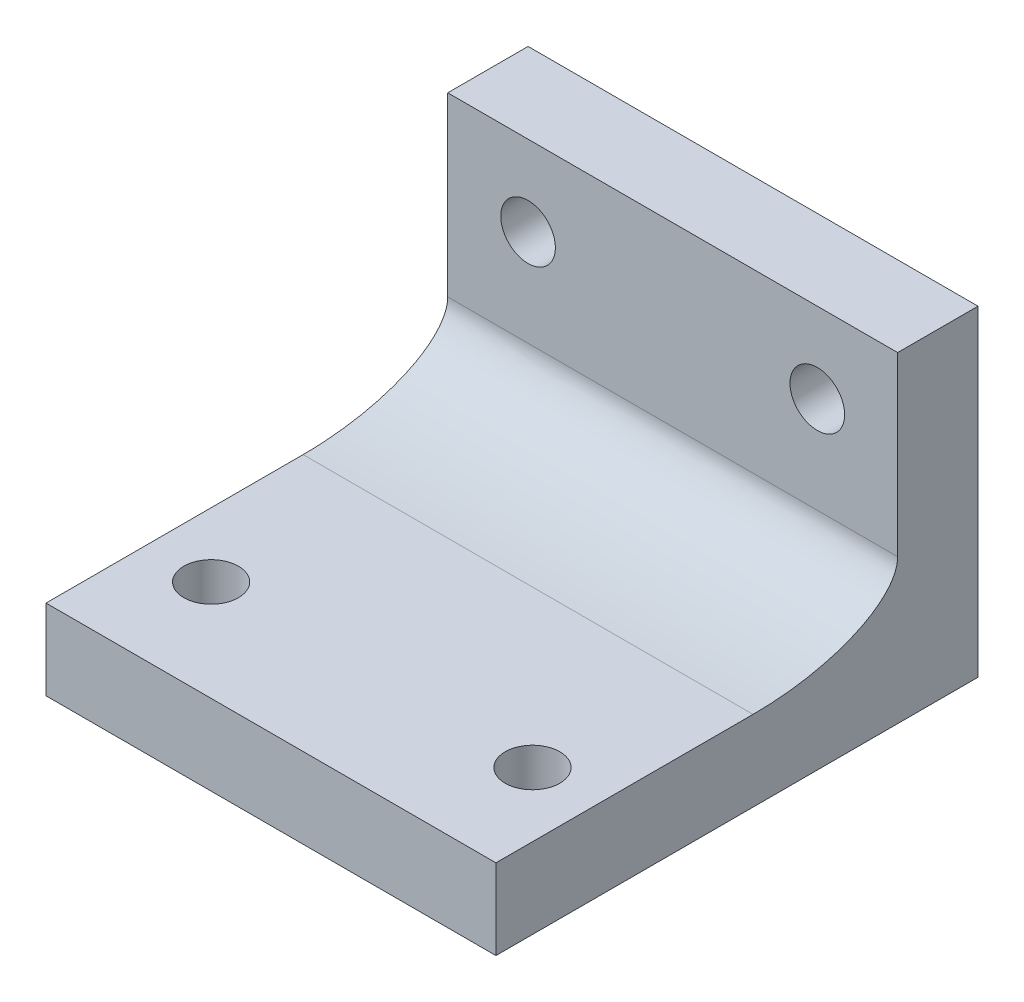
from build123d import *

# Parameters (mm, degrees)
SKETCH_1_W          = 28
SKETCH_1_H          = 30
EXTRUDE_1_DEPTH     = 5
SKETCH_2_W          = 28
SKETCH_2_H          = 5
EXTRUDE_2_DEPTH     = 15
SKETCH_3_R          = 1.7
CUT_EXTRUDE_1_DEPTH = 5
SKETCH_4_R          = 1.7
CUT_EXTRUDE_2_DEPTH = 5
FILLET_1_SIZE       = 9
FILLET_1_SIZE_2     = 4


with BuildPart() as part:
    # 草图1 → 凸台-拉伸1 (new body)
    with BuildSketch(Plane(origin=(0, 0, 0), x_dir=(1, 0, 0), z_dir=(0, 1, 0))):
        with Locations((14, -15)):
            Rectangle(SKETCH_1_W, SKETCH_1_H)
    extrude(amount=EXTRUDE_1_DEPTH)

    # 草图2 → 凸台-拉伸2 (add)
    with BuildSketch(Plane(origin=(0, 5, 0), x_dir=(1, 0, 0), z_dir=(0, 1, 0))):
        with Locations((14, -2.5)):
            Rectangle(SKETCH_2_W, SKETCH_2_H)
    extrude(amount=EXTRUDE_2_DEPTH)

    # 草图3 → 切除-拉伸1 (cut)
    with BuildSketch(Plane(origin=(0, 5, 0), x_dir=(1, 0, 0), z_dir=(0, 1, 0))):
        with Locations(Location((4, -23.725, 0), (0, 0, 270))):
            Circle(SKETCH_3_R)
        with Locations(Location((24, -23.725, 0), (0, 0, 90))):
            Circle(SKETCH_3_R)
    extrude(amount=-CUT_EXTRUDE_1_DEPTH, mode=Mode.SUBTRACT)

    # 草图4 → 切除-拉伸2 (cut)
    with BuildSketch(Plane.XY.offset(5)):
        with Locations((5, 15)):
            Circle(SKETCH_4_R)
        with Locations(Location((23, 15, 0), (0, 0, 180))):
            Circle(SKETCH_4_R)
    extrude(amount=-CUT_EXTRUDE_2_DEPTH, mode=Mode.SUBTRACT)

    # 圆角1
    # an asymmetric fillet: 9, 4 mm, written as the material it adds along each edge
    with BuildSketch(Plane(origin=(28, 5, 5), x_dir=(0, 0, 1), z_dir=(-1, 0, 0))) as fillet_1_piece_1:
        with BuildLine():
            Bezier((FILLET_1_SIZE, 0), (0, 0), (0, FILLET_1_SIZE_2), weights=[1, 0.707106781, 1])
            Line((0, FILLET_1_SIZE_2), (0, 0))
            Line((0, 0), (FILLET_1_SIZE, 0))
        make_face()
    extrude(amount=28)


solid = part.part
